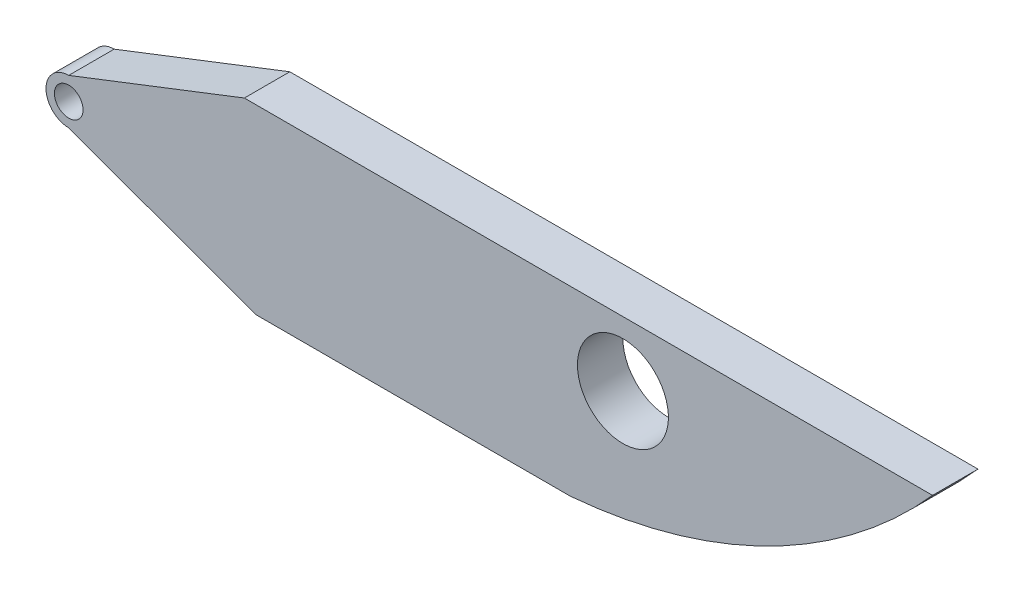
from build123d import *

# Parameters (mm, degrees)
SKETCH1_W           = 254
SKETCH1_H           = 50.8
BOSS_EXTRUDE1_DEPTH = 12.7
SKETCH3_R           = 4
CUT_EXTRUDE1_DEPTH  = 131.136274728
CUT_EXTRUDE2_DEPTH  = 131.136274728
SKETCH11_R          = 12.7
CUT_EXTRUDE3_DEPTH  = 131.136274728


with BuildPart() as part:
    # Sketch1 → Boss-Extrude1 (new body)
    with BuildSketch(Plane.XY):
        Rectangle(SKETCH1_W, SKETCH1_H)
    extrude(amount=BOSS_EXTRUDE1_DEPTH)

    # Sketch3 → Cut-Extrude1 (cut, through all)
    with BuildSketch(Plane.XY.offset(12.7)):
        with Locations((-114.3, 0)):
            Circle(SKETCH3_R)
    extrude(amount=-CUT_EXTRUDE1_DEPTH, mode=Mode.SUBTRACT)

    # Sketch5 → Cut-Extrude2 (cut, through all)
    with BuildSketch(Plane.XY.offset(12.7)):
        with BuildLine():
            Line((-62.046109456, -25.4), (-114.3, -6.35))
            ThreePointArc((-114.3, -6.35), (-120.65, 0), (-114.3, 6.35))
            Line((-114.3, 6.35), (-65.239311186, 25.4))
            Line((-65.239311186, 25.4), (-127, 25.4))
            Line((-127, 25.4), (-127, -25.4))
            Line((-127, -25.4), (-62.046109456, -25.4))
        make_face()
        with BuildLine():
            ThreePointArc((127, 25.4), (81.311032521, -9.74092592), (25.838878942, -25.4))
            Line((25.838878942, -25.4), (127, -25.4))
            Line((127, -25.4), (127, 25.4))
        make_face()
    extrude(amount=-CUT_EXTRUDE2_DEPTH, mode=Mode.SUBTRACT)

    # Sketch11 → Cut-Extrude3 (cut, through all)
    with BuildSketch(Plane(origin=(0, 0, 0), x_dir=(-1, 0, 0), z_dir=(0, 0, -1))):
        with Locations((-40.509738995, 7.378262376)):
            Circle(SKETCH11_R)
    extrude(amount=-CUT_EXTRUDE3_DEPTH, mode=Mode.SUBTRACT)


solid = part.part
